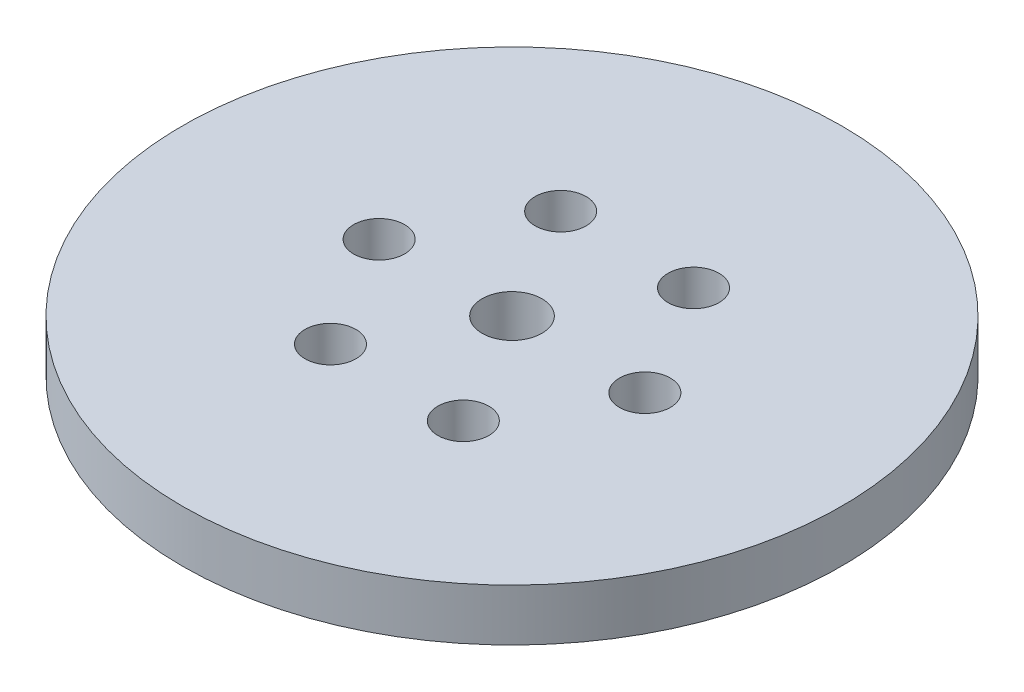
from build123d import *

# Parameters (mm, degrees)
SKETCH1_R           = 82.5
BOSS_EXTRUDE1_DEPTH = 13
SKETCH2_R           = 7.5
CUT_EXTRUDE1_DEPTH  = 118.394633608
SKETCH3_R           = 6.378950811
CUT_EXTRUDE2_DEPTH  = 11.153590283
CIRPATTERN1_COUNT   = 6


with BuildPart() as part:
    # Sketch1 → Boss-Extrude1 (new body)
    with BuildSketch(Plane(origin=(0, 0, 0), x_dir=(1, 0, 0), z_dir=(0, 1, 0))):
        Circle(SKETCH1_R)
    extrude(amount=BOSS_EXTRUDE1_DEPTH)

    # Sketch2 → Cut-Extrude1 (cut, through all)
    with BuildSketch(Plane(origin=(0, 0, 0), x_dir=(1, 0, 0), z_dir=(0, 1, 0))):
        Circle(SKETCH2_R)
    extrude(amount=CUT_EXTRUDE1_DEPTH, mode=Mode.SUBTRACT)

    # Sketch3 → Cut-Extrude2 (cut)
    with BuildSketch(Plane(origin=(0, 13, 0), x_dir=(1, 0, 0), z_dir=(0, 1, 0))):
        with Locations((-33.267934401, 0)):
            Circle(SKETCH3_R)
    cut_extrude2 = extrude(amount=-CUT_EXTRUDE2_DEPTH, mode=Mode.SUBTRACT)

    # CirPattern1: Cut-Extrude2 ×6 about axis
    cirpattern1_axis = Axis((0, 0, 0), (0, 1, 0))
    for i in range(1, CIRPATTERN1_COUNT):
        add(cut_extrude2.rotate(cirpattern1_axis, i * 360 / CIRPATTERN1_COUNT), mode=Mode.SUBTRACT)


solid = part.part
